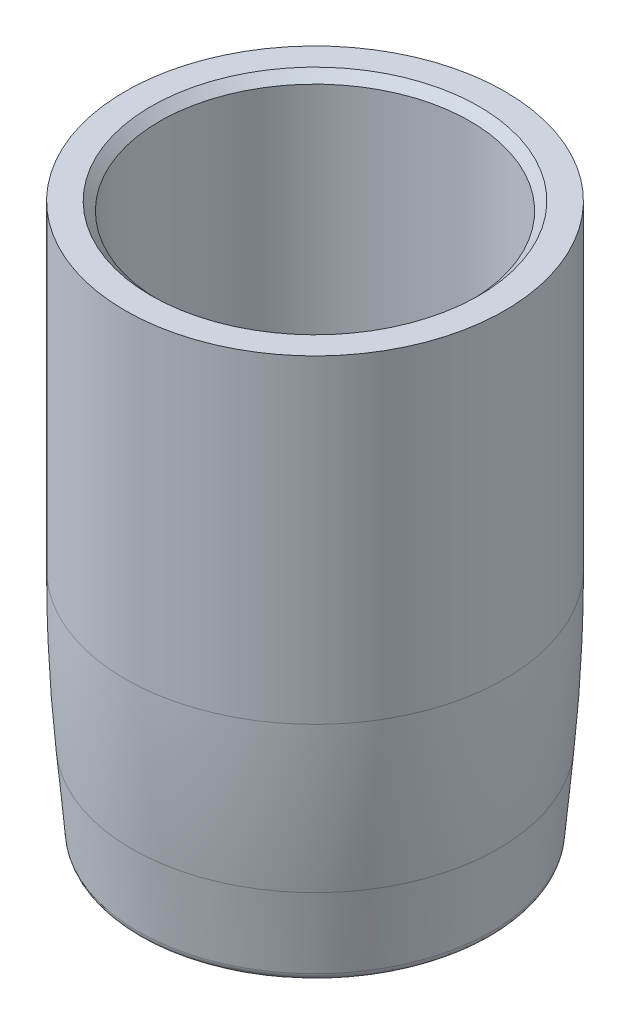
from build123d import *

# Parameters (mm, degrees)
SKETCH1_R           = 11
SKETCH1_R_2         = 5
BOSS_EXTRUDE1_DEPTH = 2
SKETCH2_R           = 11
SKETCH2_R_2         = 9
BOSS_EXTRUDE2_DEPTH = 30
CHAMFER1_SIZE       = 0.8
CHAMFER1_SIZE2      = 9.144041842
CHAMFER2_SIZE       = 0.5
FILLET1_R           = 0.5
FILLET2_R           = 100
CHAMFER3_SIZE       = 0.5


with BuildPart() as part:
    # Sketch1 → Boss-Extrude1 (new body)
    with BuildSketch(Plane(origin=(0, 0, 0), x_dir=(1, 0, 0), z_dir=(0, 1, 0))):
        with Locations(Location((0, 0, 0), (0, 0, 270))):
            Circle(SKETCH1_R)
        with Locations(Location((0, 0, 0), (0, 0, 270))):
            Circle(SKETCH1_R_2, mode=Mode.SUBTRACT)
    extrude(amount=BOSS_EXTRUDE1_DEPTH)

    # Sketch2 → Boss-Extrude2 (add)
    with BuildSketch(Plane(origin=(0, 2, 0), x_dir=(1, 0, 0), z_dir=(0, 1, 0))):
        with Locations(Location((0, 0, 0), (0, 0, 270))):
            Circle(SKETCH2_R)
        with Locations(Location((0, 0, 0), (0, 0, 270))):
            Circle(SKETCH2_R_2, mode=Mode.SUBTRACT)
    extrude(amount=BOSS_EXTRUDE2_DEPTH)

    # Chamfer1
    chamfer1_edges = [part.edges().sort_by_distance(p)[0] for p in [
        (0, 0, -11),
    ]]
    chamfer1_side = [part.faces().sort_by_distance(p)[0] for p in [
        (0, 0, -10.688873016),
    ]]
    chamfer(chamfer1_edges, length=CHAMFER1_SIZE, length2=CHAMFER1_SIZE2, reference=chamfer1_side[0])

    # Chamfer2
    chamfer2_edges = [part.edges().sort_by_distance(p)[0] for p in [
        (0, 32, -9),
    ]]
    chamfer(chamfer2_edges, length=CHAMFER2_SIZE)

    # Fillet1
    fillet1_edges = [part.edges().sort_by_distance(p)[0] for p in [
        (0, 0, -10.2),
    ]]
    fillet(fillet1_edges, radius=FILLET1_R)

    # Fillet2
    # the kernel refuses this fillet: 100 mm, written as the material it takes off along each edge
    with BuildSketch(Plane(origin=(0, 9.144041842, 0), x_dir=(0, 0, 1), z_dir=(-1, 0, 0))) as fillet2_piece_1:
        with BuildLine():
            CenterArc((11 - FILLET2_R, FILLET2_R * 0.0436609429085), FILLET2_R, 355, 5)
            Line((11, FILLET2_R * 0.0436609429085), (11, 0))
            Line((11, 0), (11 - FILLET2_R * 0.00380530190825, -FILLET2_R * 0.0434947998391))
        make_face()
    revolve(axis=Axis((0, 9.144041842, 0), (0, 1, 0)), mode=Mode.SUBTRACT)

    # Chamfer3
    chamfer3_edges = [part.edges().sort_by_distance(p)[0] for p in [
        (0, 2, -5),
    ]]
    chamfer(chamfer3_edges, length=CHAMFER3_SIZE)


solid = part.part
